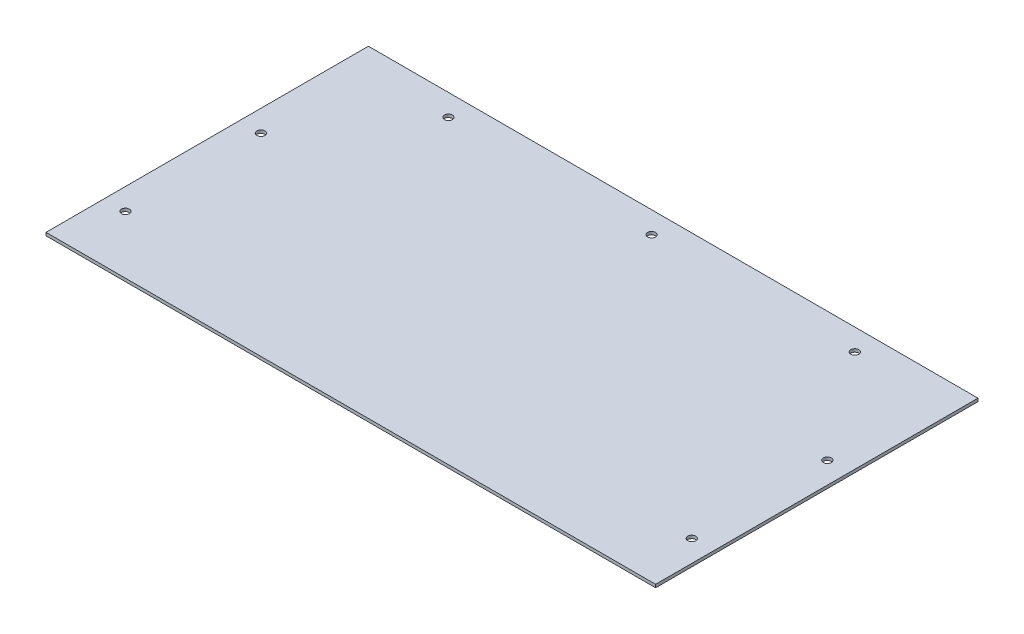
from build123d import *

# Parameters (mm, degrees)
SKETCH1_W           = 457.2
SKETCH1_H           = 2.286
BOSS_EXTRUDE1_DEPTH = 238.620000026
SKETCH2_W           = 457.2
SKETCH2_H           = 2.286
BOSS_EXTRUDE2_DEPTH = 3.175
SKETCH6_R           = 3
CUT_EXTRUDE6_DEPTH  = 2.286


with BuildPart() as part:
    # Sketch1 → Boss-Extrude1 (new body)
    with BuildSketch(Plane.XY):
        Rectangle(SKETCH1_W, SKETCH1_H)
    extrude(amount=BOSS_EXTRUDE1_DEPTH)

    # Sketch2 → Boss-Extrude2 (add)
    with BuildSketch(Plane(origin=(0, 0, 0), x_dir=(-1, 0, 0), z_dir=(0, 0, -1))):
        Rectangle(SKETCH2_W, SKETCH2_H)
    extrude(amount=BOSS_EXTRUDE2_DEPTH)

    # Sketch6 → Cut-Extrude6 (cut)
    with BuildSketch(Plane.XZ.offset(1.143)):
        with Locations((-212.419, 195.244793717)):
            Circle(SKETCH6_R)
        with Locations((212.419, 195.244793717)):
            Circle(SKETCH6_R)
        with Locations((212.419, 93.644793717)):
            Circle(SKETCH6_R)
        with Locations((152.4, 13.0175)):
            Circle(SKETCH6_R)
        with Locations((0, 13.0175)):
            Circle(SKETCH6_R)
        with Locations((-152.4, 13.0175)):
            Circle(SKETCH6_R)
        with Locations((-212.419, 93.644793717)):
            Circle(SKETCH6_R)
    extrude(amount=-CUT_EXTRUDE6_DEPTH, mode=Mode.SUBTRACT)


solid = part.part
